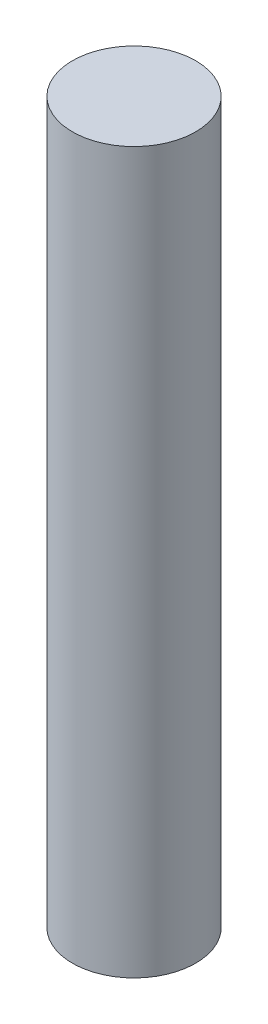
from build123d import *

# Parameters (mm, degrees)
SKETCH1_R           = 2.5
BOSS_EXTRUDE1_DEPTH = 29.21


with BuildPart() as part:
    # Sketch1 → Boss-Extrude1 (new body)
    with BuildSketch(Plane(origin=(0, 0, 0), x_dir=(1, 0, 0), z_dir=(0, 1, 0))):
        Circle(SKETCH1_R)
    extrude(amount=BOSS_EXTRUDE1_DEPTH)


solid = part.part
